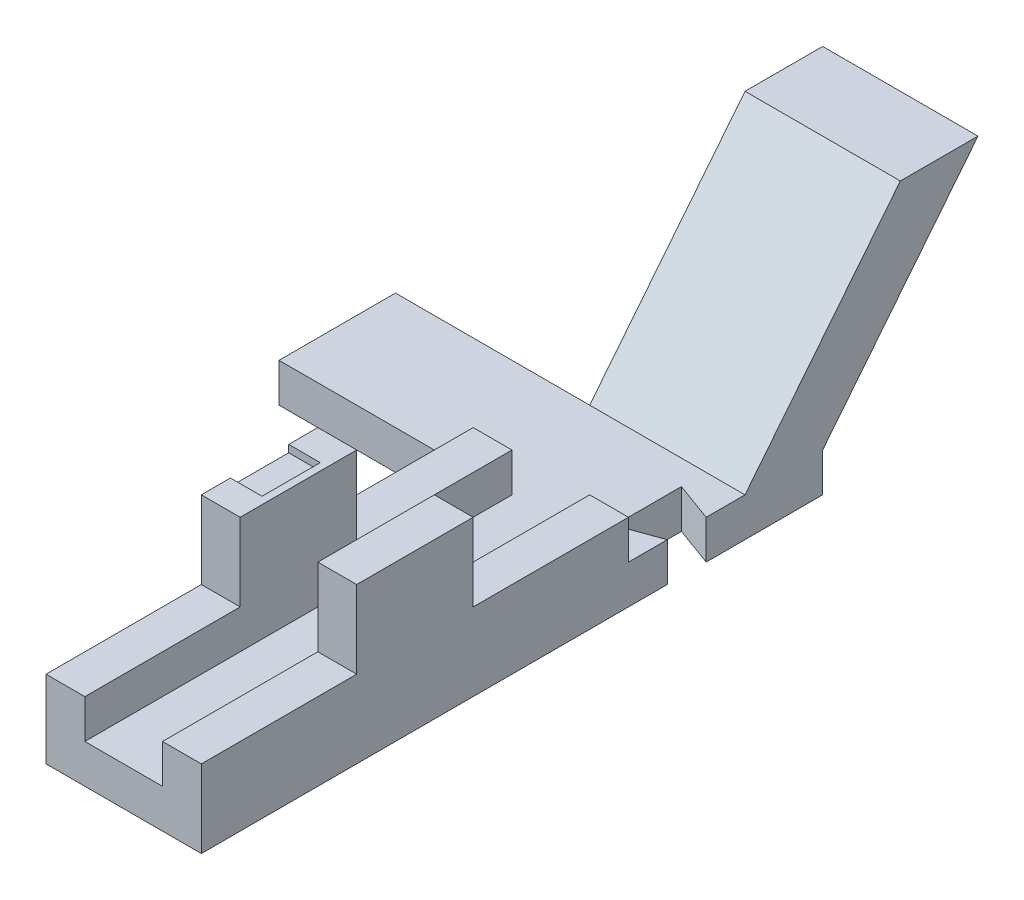
from build123d import *

# Parameters (mm, degrees)
SKETCH1_W           = 101.6
SKETCH1_H           = 355.6
BOSS_EXTRUDE1_DEPTH = 25.4
SKETCH2_W           = 76.2
SKETCH2_H           = 25.4
BOSS_EXTRUDE2_DEPTH = 127
SKETCH3_W           = 25.4
SKETCH3_H           = 279.4
BOSS_EXTRUDE3_DEPTH = 25.4
SKETCH5_W           = 25.4
SKETCH5_H           = 279.4
BOSS_EXTRUDE4_DEPTH = 25.4
SKETCH6_W           = 25.4
SKETCH6_H           = 76.2
BOSS_EXTRUDE5_DEPTH = 50.8
SKETCH8_W           = 25.4
SKETCH8_H           = 76.2
BOSS_EXTRUDE6_DEPTH = 50.8
SKETCH9_W           = 101.6
SKETCH9_H           = 25.4
BOSS_EXTRUDE7_DEPTH = 50.8
LOFT1_DEPTH         = 101.6
CUT_EXTRUDE2_DEPTH  = 539.816024431
SKETCH18_W          = 20.6502
SKETCH18_H          = 38.1
CUT_EXTRUDE3_DEPTH  = 4.7498


# Read off the part's stored shape, not the designer's step: Loft1
with BuildPart() as part:
    # Sketch1 → Boss-Extrude1 (new body)
    with BuildSketch(Plane(origin=(0, 0, 0), x_dir=(1, 0, 0), z_dir=(0, 1, 0))):
        with Locations((50.8, 177.8)):
            Rectangle(SKETCH1_W, SKETCH1_H)
    extrude(amount=BOSS_EXTRUDE1_DEPTH)

    # Sketch2 → Boss-Extrude2 (add)
    with BuildSketch(Plane.ZY):
        with Locations((-317.5, 12.7)):
            Rectangle(SKETCH2_W, SKETCH2_H)
    extrude(amount=BOSS_EXTRUDE2_DEPTH)

    # Sketch3 → Boss-Extrude3 (add)
    with BuildSketch(Plane(origin=(0, 25.4, 0), x_dir=(1, 0, 0), z_dir=(0, 1, 0))):
        with Locations((12.7, 139.7)):
            Rectangle(SKETCH3_W, SKETCH3_H)
    extrude(amount=BOSS_EXTRUDE3_DEPTH)

    # Sketch5 → Boss-Extrude4 (add)
    with BuildSketch(Plane(origin=(0, 25.4, 0), x_dir=(1, 0, 0), z_dir=(0, 1, 0))):
        with Locations((88.9, 139.7)):
            Rectangle(SKETCH5_W, SKETCH5_H)
    extrude(amount=BOSS_EXTRUDE4_DEPTH)

    # Sketch6 → Boss-Extrude5 (add)
    with BuildSketch(Plane(origin=(0, 50.8, 0), x_dir=(1, 0, 0), z_dir=(0, 1, 0))):
        with Locations((12.7, 139.7)):
            Rectangle(SKETCH6_W, SKETCH6_H)
    extrude(amount=BOSS_EXTRUDE5_DEPTH)

    # Sketch8 → Boss-Extrude6 (add)
    with BuildSketch(Plane(origin=(0, 50.8, 0), x_dir=(1, 0, 0), z_dir=(0, 1, 0))):
        with Locations((88.9, 139.7)):
            Rectangle(SKETCH8_W, SKETCH8_H)
    extrude(amount=BOSS_EXTRUDE6_DEPTH)

    # Sketch9 → Boss-Extrude7 (add)
    with BuildSketch(Plane(origin=(0, 0, -355.6), x_dir=(-1, 0, 0), z_dir=(0, 0, -1))):
        with Locations((-50.8, 12.7)):
            Rectangle(SKETCH9_W, SKETCH9_H)
    extrude(amount=BOSS_EXTRUDE7_DEPTH)

    # Loft1 outline → Loft1 (add)
    with BuildSketch(Plane.YZ):
        Polygon((25.4, -406.4), (152.4, -508.000697031), (152.4, -457.200697031), (25.4, -355.6), align=None)
    extrude(amount=LOFT1_DEPTH)

    # Sketch17 → Cut-Extrude2 (cut, through all)
    with BuildSketch(Plane(origin=(0, 25.4, 0), x_dir=(1, 0, 0), z_dir=(0, 1, 0))):
        Polygon((101.6, 304.8), (101.6, 330.2), (76.128136844, 339.471), (76.128136844, 295.529), align=None)
    extrude(amount=-CUT_EXTRUDE2_DEPTH, mode=Mode.SUBTRACT)

    # Sketch18 → Cut-Extrude3 (cut)
    with BuildSketch(Plane(origin=(0, 101.6, 0), x_dir=(1, 0, 0), z_dir=(0, 1, 0))):
        with Locations((10.3251, 139.7)):
            Rectangle(SKETCH18_W, SKETCH18_H)
    extrude(amount=-CUT_EXTRUDE3_DEPTH, mode=Mode.SUBTRACT)


solid = part.part
